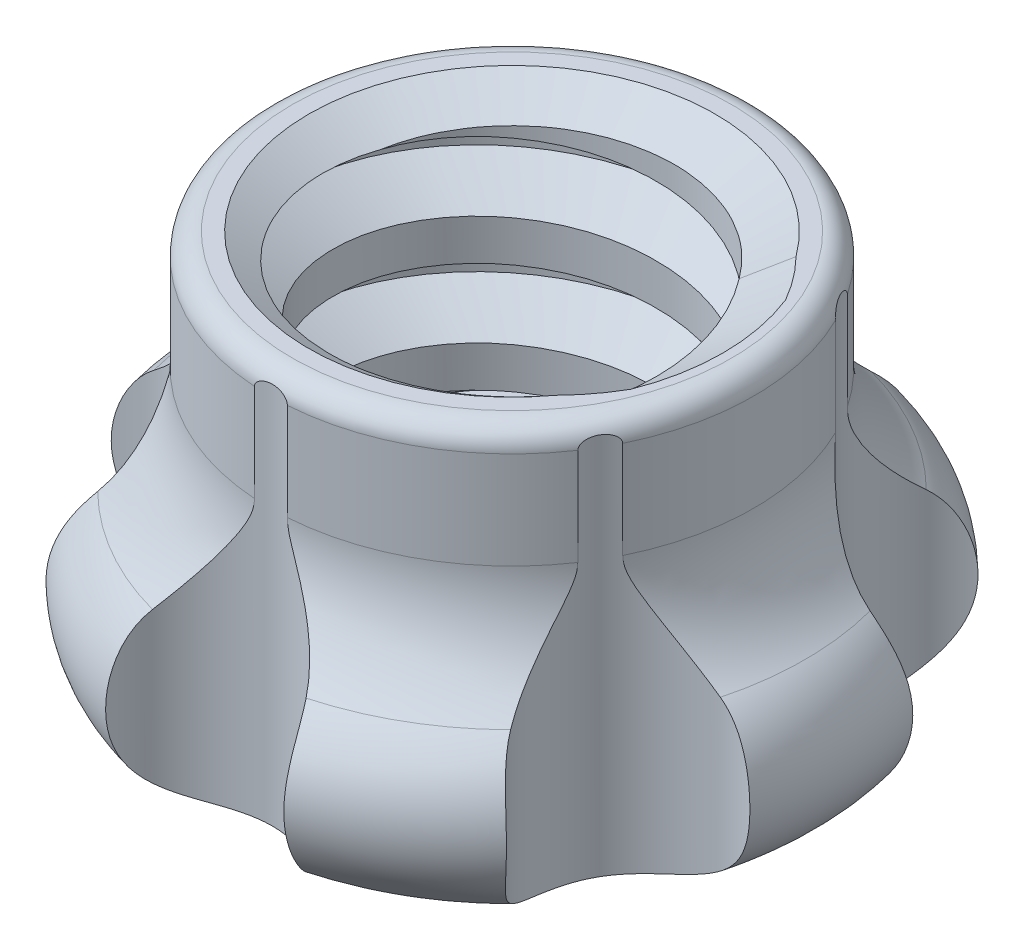
from build123d import *

# Parameters (mm, degrees)
SKETCH2_R          = 4.094475301
CUT_EXTRUDE1_DEPTH = 28.820855659
SKETCH3_R          = 5
CUT_EXTRUDE2_DEPTH = 28.523581999
SKETCH4_R          = 9.6
CUT_EXTRUDE3_DEPTH = 13
SWEEP1_PITCH       = 5
CUT_EXTRUDE4_START = 10
SKETCH7_R          = 11
CUT_EXTRUDE4_DEPTH = 10
SKETCH8_R          = 9.25
CUT_EXTRUDE5_DEPTH = 3
CUT_EXTRUDE5_DRAFT = -60
SKETCH9_R          = 6.5
CUT_EXTRUDE6_DEPTH = 5
CUT_EXTRUDE6_DRAFT = -10
FILLET1_R          = 0.5


with BuildPart() as part:
    # Sketch1 → Revolve1 (revolve)
    with BuildSketch(Plane.XY):
        with BuildLine():
            Line((0, 18), (0, 0))
            Line((0, 0), (-10.645344247, 0))
            ThreePointArc((-10.645344247, 0), (-14.761191098, 2.93239297), (-13.333876304, 7.780268414))
            ThreePointArc((-13.333876304, 7.780268414), (-11.614412286, 9.910803548), (-11, 12.578805424))
            Line((-11, 12.578805424), (-11, 17))
            ThreePointArc((-11, 17), (-10.707106781, 17.707106781), (-10, 18))
            Line((-10, 18), (0, 18))
        make_face()
    revolve(axis=Axis((0, 18, 0), (0, -1, 0)))

    # Sketch2 → Cut-Extrude1 (cut, through all)
    with BuildSketch(Plane.XZ):
        with Locations((0, 15)):
            Circle(SKETCH2_R)
        with Locations((12.990381057, 7.5)):
            Circle(SKETCH2_R)
        with Locations((12.990381057, -7.5)):
            Circle(SKETCH2_R)
        with Locations((0, -15)):
            Circle(SKETCH2_R)
        with Locations((-12.990381057, -7.5)):
            Circle(SKETCH2_R)
        with Locations((-12.990381057, 7.5)):
            Circle(SKETCH2_R)
    extrude(amount=-CUT_EXTRUDE1_DEPTH, mode=Mode.SUBTRACT)

    # Sketch3 → Cut-Extrude2 (cut, through all)
    with BuildSketch(Plane.XZ):
        Circle(SKETCH3_R)
    extrude(amount=-CUT_EXTRUDE2_DEPTH, mode=Mode.SUBTRACT)

    # Sketch4 → Cut-Extrude3 (cut)
    with BuildSketch(Plane(origin=(0, 18, 0), x_dir=(1, 0, 0), z_dir=(0, 1, 0))):
        with Locations(Location((0, 0, 0), (0, 0, 180))):
            Circle(SKETCH4_R)
    extrude(amount=-CUT_EXTRUDE3_DEPTH, mode=Mode.SUBTRACT)

    # Sweep1: the profile of Sketch6 profile screwed along a right-hand helix of 4.1 turns, 12 arcs to a turn; built about Z, then put on its axis
    sweep1_z = Axis((0, 0, 0), (0, 0, 1))
    sweep1_corners = [(7.4, 0, -0.929829408), (7.4, 0, 0.929829408), (9.6003, 0, 2.200173205), (9.6003, 0, -2.200173205)]
    with BuildLine(mode=Mode.PRIVATE) as sweep1_profile:
        Line(sweep1_corners[0], sweep1_corners[1])
        Line(sweep1_corners[1], sweep1_corners[2])
        Line(sweep1_corners[2], sweep1_corners[3])
        Line(sweep1_corners[3], sweep1_corners[0])
    sweep1_cap = Face(sweep1_profile.wire())
    sweep1_turn_angles = [0, 15, 30, 45, 60, 75, 90, 105, 120, 135, 150, 165, 180, 195, 210, 225, 240, 255, 270, 285, 300, 315, 330, 345, 360]
    sweep1_turn_weights = [1, 0.9659258262890683, 1, 0.9659258262890683, 1, 0.9659258262890683, 1, 0.9659258262890683, 1, 0.9659258262890683, 1, 0.9659258262890683, 1, 0.9659258262890683, 1, 0.9659258262890683, 1, 0.9659258262890683, 1, 0.9659258262890683, 1, 0.9659258262890683, 1, 0.9659258262890683, 1]
    sweep1_turn_rails = [Edge.make_bspline([Vector(p[0], p[1], 0).rotate(sweep1_z, sweep1_turn_angles[k]) / sweep1_turn_weights[k] + Vector(0, 0, p[2] + SWEEP1_PITCH * sweep1_turn_angles[k] / 360) for k in range(25)], [0, 0, 0, 1, 1, 2, 2, 3, 3, 4, 4, 5, 5, 6, 6, 7, 7, 8, 8, 9, 9, 10, 10, 11, 11, 12, 12, 12], 2, sweep1_turn_weights) for p in sweep1_corners]
    sweep1_turn_sides = [Face.make_surface_from_curves(sweep1_turn_rails[p[0]], sweep1_turn_rails[p[1]]) for p in [(0, 1), (1, 2), (2, 3), (3, 0)]]
    sweep1_last_angles = [1440, 1455, 1470, 1473, 1476]
    sweep1_last_weights = [1, 0.9659258262890683, 1, 0.9986295347545721, 1]
    sweep1_last_rails = [Edge.make_bspline([Vector(p[0], p[1], 0).rotate(sweep1_z, sweep1_last_angles[k]) / sweep1_last_weights[k] + Vector(0, 0, p[2] + SWEEP1_PITCH * sweep1_last_angles[k] / 360) for k in range(5)], [0, 0, 0, 1, 1, 2, 2, 2], 2, sweep1_last_weights) for p in sweep1_corners]
    sweep1_last_sides = [Face.make_surface_from_curves(sweep1_last_rails[p[0]], sweep1_last_rails[p[1]]) for p in [(0, 1), (1, 2), (2, 3), (3, 0)]]
    sweep1 = Plane(origin=(0, 23, 0), x_dir=(-1, 0, 0), z_dir=(0, -1, 0)) * Solid(Shell([*[p.moved(Location((0, 0, SWEEP1_PITCH * i))) for i in range(4) for p in sweep1_turn_sides], *sweep1_last_sides, sweep1_cap, sweep1_cap.rotate(sweep1_z, 1476).moved(Location((0, 0, SWEEP1_PITCH * 1476 / 360)))]))
    add(sweep1)

    # Sketch7 → Cut-Extrude4 (cut)
    with BuildSketch(Plane(origin=(0, 18, 0), x_dir=(1, 0, 0), z_dir=(0, 1, 0)).offset(CUT_EXTRUDE4_START)):
        Circle(SKETCH7_R)
    extrude(amount=-CUT_EXTRUDE4_DEPTH, mode=Mode.SUBTRACT)


with BuildPart() as cut_extrude5_tool:
    # Sketch8 → Cut-Extrude5 (with draft: the straight prism first)
    with BuildSketch(Plane(origin=(0, 18, 0), x_dir=(1, 0, 0), z_dir=(0, 1, 0))):
        Circle(SKETCH8_R)
    extrude(amount=-CUT_EXTRUDE5_DEPTH)
    # Cut-Extrude5: the draft: its side faces are tilted about the plane it starts from
    cut_extrude5_sides = [cut_extrude5_tool.faces().sort_by_distance(p)[0] for p in [
        (-9.25, 16.5, 0),
    ]]
    draft(cut_extrude5_sides, Plane(origin=(0, 18, 0), x_dir=(1, 0, 0), z_dir=(0, 1, 0)), CUT_EXTRUDE5_DRAFT)


with BuildPart() as part_1:
    add(part.part)

    # Cut-Extrude5: cut by cut_extrude5_tool
    add(cut_extrude5_tool.part, mode=Mode.SUBTRACT)


with BuildPart() as cut_extrude6_tool:
    # Sketch9 → Cut-Extrude6 (with draft: the straight prism first)
    with BuildSketch(Plane(origin=(0, 5, 0), x_dir=(1, 0, 0), z_dir=(0, 1, 0))):
        Circle(SKETCH9_R)
    extrude(amount=-CUT_EXTRUDE6_DEPTH)
    # Cut-Extrude6: the draft: its side faces are tilted about the plane it starts from
    cut_extrude6_sides = [cut_extrude6_tool.faces().sort_by_distance(p)[0] for p in [
        (-6.5, 2.5, 0),
    ]]
    draft(cut_extrude6_sides, Plane(origin=(0, 5, 0), x_dir=(1, 0, 0), z_dir=(0, 1, 0)), CUT_EXTRUDE6_DRAFT)


with BuildPart() as part_2:
    add(part_1.part)

    # Cut-Extrude6: cut by cut_extrude6_tool
    add(cut_extrude6_tool.part, mode=Mode.SUBTRACT)

    # Fillet1
    fillet1_edges = [part_2.edges().sort_by_distance(p)[0] for p in [
        (-5.618365096, 0, 0),
    ]]
    fillet(fillet1_edges, radius=FILLET1_R)


solid = part_2.part
